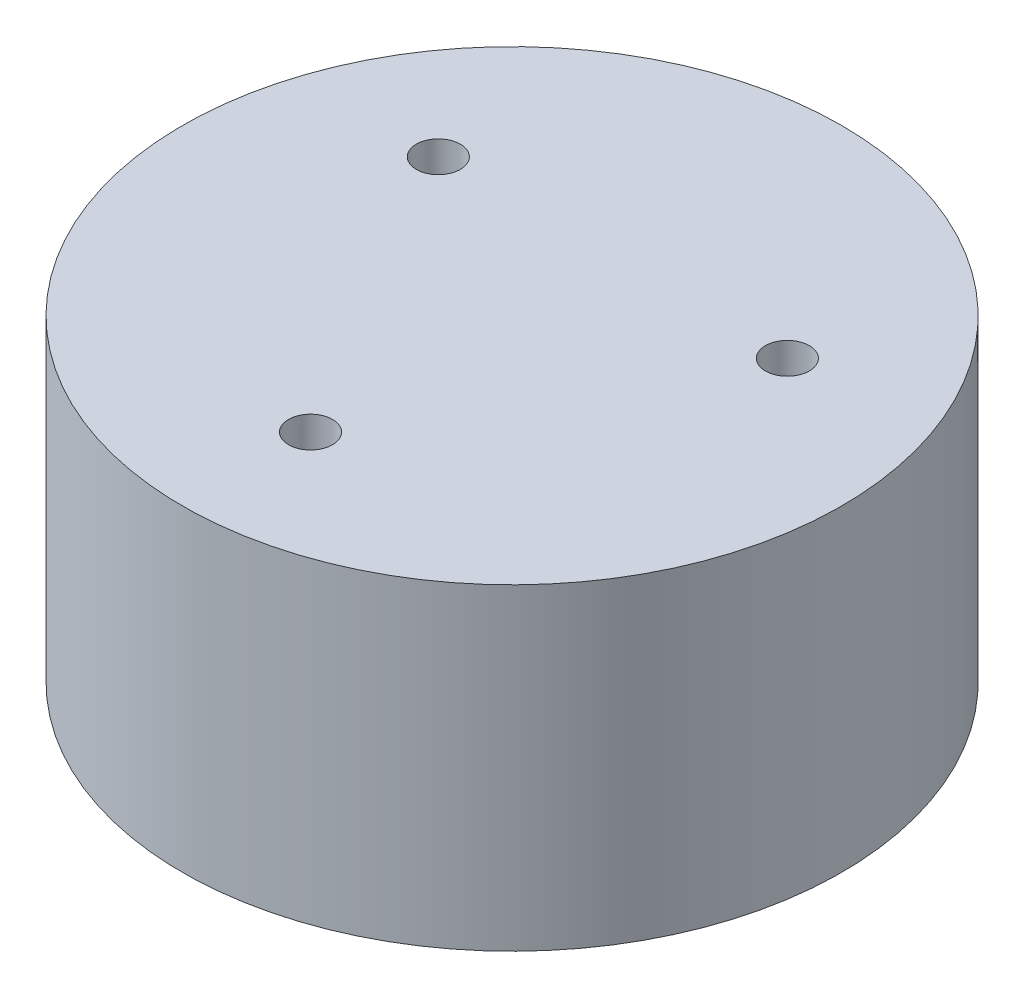
from build123d import *
from OCP.BRepFilletAPI import BRepFilletAPI_MakeChamfer

# Parameters (mm, degrees)
SKETCH2_R                     = 27
BOSS_EXTRUDE2_DEPTH           = 26
CBORE_FOR_M3_SHCS1_AT_2_COUNT = 2
CBORE_FOR_M3_SHCS1_AT_2_PITCH = 28.596158833
CBORE_FOR_M3_SHCS1_AT_3_COUNT = 2
CBORE_FOR_M3_SHCS1_AT_3_PITCH = 28.596158833
HOLE1_D                       = 6.4
HOLE1_DEPTH                   = 15
HOLE1_CBORE_D                 = 7.3
HOLE1_CBORE_DEPTH             = 2
CHAMFER1_SIZE                 = 2
CHAMFER1_SIZE_2               = 0.45


with BuildPart() as part:
    # Sketch2 → Boss-Extrude2 (new body)
    with BuildSketch(Plane(origin=(0, 0, 0), x_dir=(1, 0, 0), z_dir=(0, 1, 0))):
        with Locations(Location((0, 0, 0), (0, 0, 90))):
            Circle(SKETCH2_R)
    extrude(amount=BOSS_EXTRUDE2_DEPTH)

    # Sketch5 → CBORE for M3 SHCS1 (revolve, cut)
    with BuildSketch(Plane(origin=(0, 0, 16.51), x_dir=(0, 0, -1), z_dir=(1, 0, 0))):
        Polygon((0, 0), (0, 26), (1.8, 26), (1.8, 18), (3.25, 18), (3.25, 0.025), (3.275, 0), align=None)
    cbore_for_m3_shcs1 = revolve(axis=Axis((0, -6.35, 16.51), (0, 1, 0)), mode=Mode.SUBTRACT)

    # CBORE for M3 SHCS1 at 2: CBORE for M3 SHCS1 ×2
    with Locations(*[Vector(0.5000000000000012, 0, -0.8660254037844379) * (i * CBORE_FOR_M3_SHCS1_AT_2_PITCH) for i in range(1, CBORE_FOR_M3_SHCS1_AT_2_COUNT)]):
        add(cbore_for_m3_shcs1, mode=Mode.SUBTRACT)

    # CBORE for M3 SHCS1 at 3: CBORE for M3 SHCS1 ×2
    with Locations(*[Vector(-0.4999999999999978, 0, -0.8660254037844399) * (i * CBORE_FOR_M3_SHCS1_AT_3_PITCH) for i in range(1, CBORE_FOR_M3_SHCS1_AT_3_COUNT)]):
        add(cbore_for_m3_shcs1, mode=Mode.SUBTRACT)

    # Hole1
    with Locations(Plane(origin=(0, 0, 0), x_dir=(-1, 0, 0), z_dir=(0, -1, 0))):
        with Locations((14.298079416, -8.255), (0, 16.51), (-14.298079416, -8.255)):
            CounterBoreHole(HOLE1_D / 2, HOLE1_CBORE_D / 2, HOLE1_CBORE_DEPTH, depth=HOLE1_DEPTH)

    # Chamfer1
    chamfer1_edges_1 = [part.edges().sort_by_distance(p)[0] for p in [
        (17.948079416, 2, 8.255),
    ]]
    chamfer1_side_1 = [part.faces().sort_by_distance(p)[0] for p in [
        (17.948079416, 1.991, 8.255),
    ]]
    chamfer1_edges_2 = [part.edges().sort_by_distance(p)[0] for p in [
        (3.65, 2, -16.51),
    ]]
    chamfer1_side_2 = [part.faces().sort_by_distance(p)[0] for p in [
        (3.65, 1.991, -16.51),
    ]]
    chamfer1_edges_3 = [part.edges().sort_by_distance(p)[0] for p in [
        (-10.648079416, 2, 8.255),
    ]]
    chamfer1_side_3 = [part.faces().sort_by_distance(p)[0] for p in [
        (-10.648079416, 1.991, 8.255),
    ]]
    chamfer1 = BRepFilletAPI_MakeChamfer(part.part.solid().wrapped)
    for e in chamfer1_edges_1:
        chamfer1.Add(CHAMFER1_SIZE - 0.0001, CHAMFER1_SIZE_2 - 0.0001, e.wrapped, chamfer1_side_1[0].wrapped)
    for e in chamfer1_edges_2:
        chamfer1.Add(CHAMFER1_SIZE - 0.0001, CHAMFER1_SIZE_2 - 0.0001, e.wrapped, chamfer1_side_2[0].wrapped)
    for e in chamfer1_edges_3:
        chamfer1.Add(CHAMFER1_SIZE - 0.0001, CHAMFER1_SIZE_2 - 0.0001, e.wrapped, chamfer1_side_3[0].wrapped)
    add(Compound.cast(chamfer1.Shape()), mode=Mode.REPLACE)  # a hair under: the kernel refuses the full size


solid = part.part
